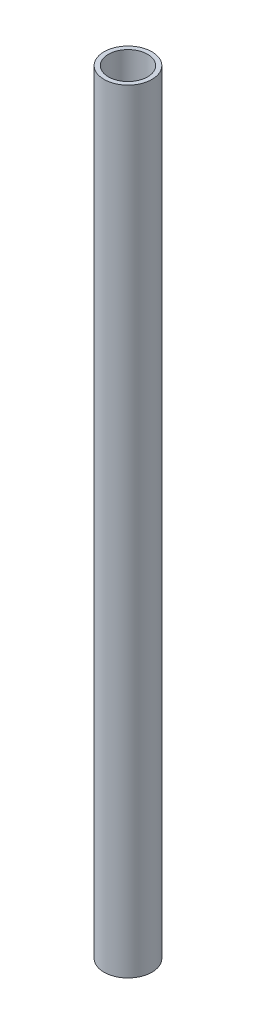
from build123d import *

# Parameters (mm, degrees)
SKETCH_1_R      = 11
SKETCH_1_R_2    = 9
EXTRUDE_1_DEPTH = 355


with BuildPart() as part:
    # Эскиз1 → Вытянуть1 (new body)
    with BuildSketch(Plane(origin=(0, 0, 0), x_dir=(1, 0, 0), z_dir=(0, 1, 0))):
        Circle(SKETCH_1_R)
        Circle(SKETCH_1_R_2, mode=Mode.SUBTRACT)
    extrude(amount=EXTRUDE_1_DEPTH)


solid = part.part
